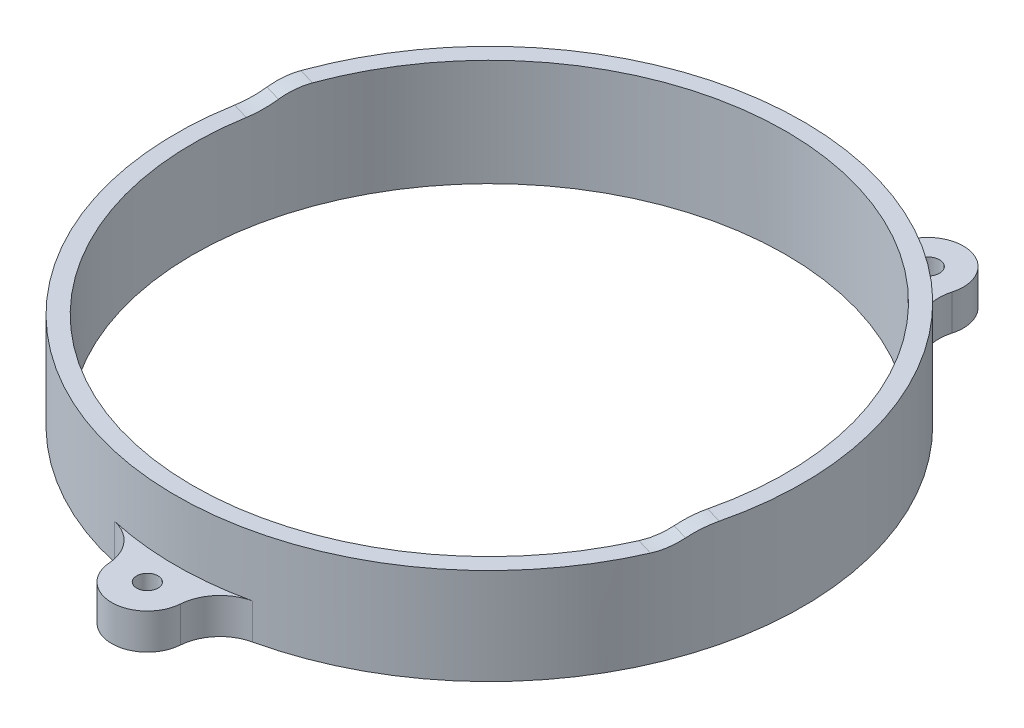
from build123d import *

# Parameters (mm, degrees)
SKETCH_1_R          = 44
SKETCH_1_R_2        = 41.6
EXTRUDE_1_DEPTH     = 15
SKETCH_2_R          = 5
SKETCH_2_R_2        = 1.5
SKETCH_2_R_3        = 1.65
EXTRUDE_2_DEPTH     = 5
FILLET_1_R          = 6
CUT_EXTRUDE_START   = -1.5
CUT_EXTRUDE_1_DEPTH = 1.5
FILLET_2_R          = 10
FILLET_START        = -45
FILLET_3_DEPTH      = 90


with BuildPart() as part:
    # 草图1 → 凸台-拉伸1 (new body)
    with BuildSketch(Plane(origin=(0, 0, 0), x_dir=(1, 0, 0), z_dir=(0, 1, 0))):
        with Locations(Location((0, 0, 0), (0, 0, 270))):
            Circle(SKETCH_1_R)
        with Locations(Location((0, 0, 0), (0, 0, 270))):
            Circle(SKETCH_1_R_2, mode=Mode.SUBTRACT)
    extrude(amount=EXTRUDE_1_DEPTH)

    # 草图2 → 凸台-拉伸2 (add)
    # profile 1 of 3: a face of its own
    with BuildSketch(Plane.XZ):
        with Locations((0, 48)):
            Circle(SKETCH_2_R)
        with Locations(Location((0, 48, 0), (0, 0, 270))):
            Circle(SKETCH_2_R_2, mode=Mode.SUBTRACT)
    # profile 2 of 3: a face of its own
    with BuildSketch(Plane.XZ):
        with Locations((-16.41696688, -45.105245798)):
            Circle(SKETCH_2_R)
        with Locations(Location((-16.41696688, -45.105245798, 0), (0, 0, 270))):
            Circle(SKETCH_2_R_3, mode=Mode.SUBTRACT)
    # profile 3 of 3: a face of its own
    with BuildSketch(Plane.XZ):
        with Locations((16.41696688, -45.105245798)):
            Circle(SKETCH_2_R)
        with Locations(Location((16.41696688, -45.105245798, 0), (0, 0, 90))):
            Circle(SKETCH_2_R_3, mode=Mode.SUBTRACT)
    extrude(amount=-EXTRUDE_2_DEPTH)

    # 圆角1
    fillet_1_edges = [part.edges().sort_by_distance(p)[0] for p in [
        (2.870750936, 2.5, 43.90625),
        (-2.870750936, 2.5, 43.90625),
        (-17.714445389, 2.5, -40.276524485),
        (-12.319198447, 2.5, -42.240233778),
        (12.319198447, 2.5, -42.240233778),
        (17.714445389, 2.5, -40.276524485),
    ]]
    fillet(fillet_1_edges, radius=FILLET_1_R)

    # 草图3 → 切除-拉伸1 (cut)
    with BuildSketch(Plane(origin=(0, 15, 0), x_dir=(1, 0, 0), z_dir=(0, 1, 0)).offset(CUT_EXTRUDE_START)):
        with BuildLine():
            Line((42.117616116, -12.732101662), (39.8202916, -12.03762339))
            ThreePointArc((39.8202916, -12.03762339), (-12.03762339, -39.8202916), (-39.8202916, 12.03762339))
            Line((-39.8202916, 12.03762339), (-42.117616116, 12.732101662))
            ThreePointArc((-42.117616116, 12.732101662), (-12.732101662, -42.117616116), (42.117616116, -12.732101662))
        make_face()
    extrude(amount=CUT_EXTRUDE_1_DEPTH, mode=Mode.SUBTRACT)

    # 圆角2
    # the kernel refuses this fillet: 10 mm, written as the material it adds along each edge
    with BuildSketch(Plane(origin=(-27.214137615, 13.5, -8.22679911), x_dir=(-0.28936594687336814, 0, 0.9572185480808858), z_dir=(-0.9572185480808859, 0, -0.28936594687336814))) as fillet_2_piece_1_section:
        with BuildLine():
            CenterArc((5.267826876, 10), FILLET_2_R, 238.211669383, 31.788330617)
            Line((0, 1.5), (-0.105356538, 1.33))
            ThreePointArc((-0.105356538, 1.33), (-0.2, 0.75), (-0.2, 0))
            Line((-0.2, 0), (0, -0.2))
            Line((0, -0.2), (5.267826876, -0.2))
            Line((5.267826876, -0.2), (5.267826876, 0))
        make_face()
    fillet_2_piece_1 = extrude(amount=28.739134382, mode=Mode.PRIVATE)
    fillet_2_piece_1 = fillet_2_piece_1 & Plane(origin=(0, 13.5, 0), x_dir=(0, 0, 1), z_dir=(0, -1, 0)) * Cylinder(44, 79, mode=Mode.PRIVATE)
    fillet_2_piece_1 = fillet_2_piece_1 - Plane(origin=(0, 13.5, 0), x_dir=(0, 0, 1), z_dir=(0, -1, 0)) * Cylinder(41.6, 79, mode=Mode.PRIVATE)
    add(fillet_2_piece_1)
    with BuildSketch(Plane(origin=(54.723770101, 13.5, 16.542925943), x_dir=(-0.2893659468733635, 0, 0.9572185480808872), z_dir=(-0.9572185480808872, 0, -0.2893659468733635))) as fillet_2_piece_2_section:
        with BuildLine():
            CenterArc((5.267826876, 10), FILLET_2_R, 238.211669383, 31.788330617)
            Line((0, 1.5), (-0.105356538, 1.33))
            ThreePointArc((-0.105356538, 1.33), (-0.2, 0.75), (-0.2, 0))
            Line((-0.2, 0), (0, -0.2))
            Line((0, -0.2), (5.267826876, -0.2))
            Line((5.267826876, -0.2), (5.267826876, 0))
        make_face()
    fillet_2_piece_2 = extrude(amount=28.739134382, mode=Mode.PRIVATE)
    fillet_2_piece_2 = fillet_2_piece_2 & Plane(origin=(0, 13.5, 0), x_dir=(0, 0, 1), z_dir=(0, -1, 0)) * Cylinder(44, 79, mode=Mode.PRIVATE)
    fillet_2_piece_2 = fillet_2_piece_2 - Plane(origin=(0, 13.5, 0), x_dir=(0, 0, 1), z_dir=(0, -1, 0)) * Cylinder(41.6, 79, mode=Mode.PRIVATE)
    add(fillet_2_piece_2)

    # 圆角3: read off the stored shape, not the designer's step
    # 圆角3 outline → 圆角3 (cut)
    with BuildSketch(Plane(origin=(0, 0, 0), x_dir=(0, 1, 0), z_dir=(0.9572185480808874, 0, 0.2893659468733631)).offset(FILLET_START)):
        with BuildLine():
            ThreePointArc((14.25, 1.468155838), (14.810708435, -0.395023527), (15, -2.3315152))
            Line((15, -2.3315152), (15, 0))
            ThreePointArc((15, 0), (14.594692852, 0.718595666), (14.25, 1.468155838))
        make_face()
    extrude(amount=FILLET_3_DEPTH, mode=Mode.SUBTRACT)


solid = part.part
